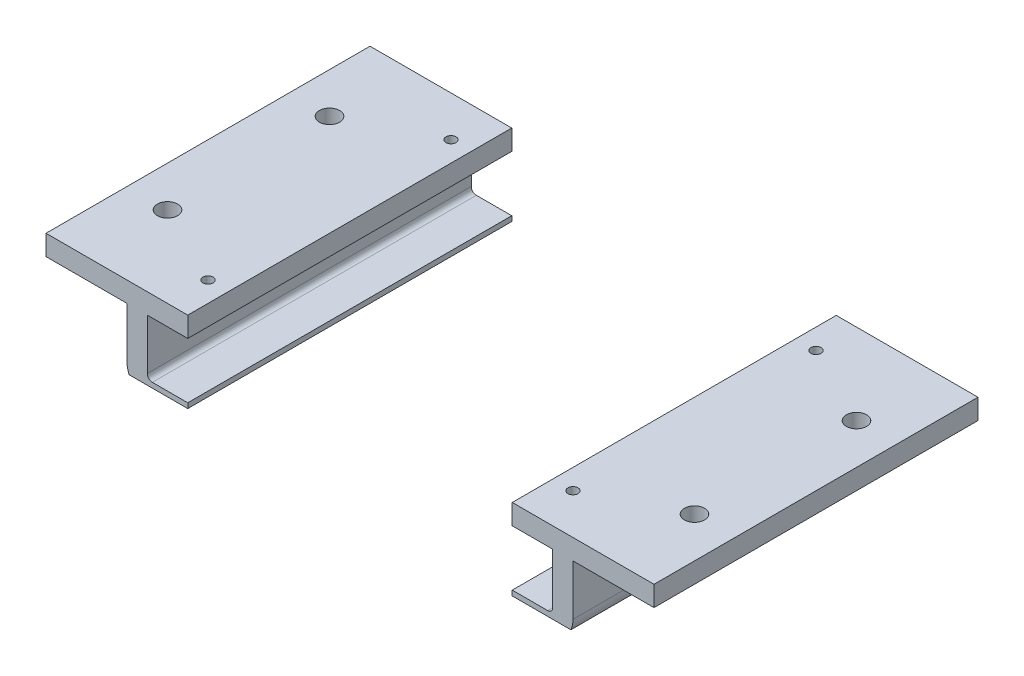
from build123d import *

# Parameters (mm, degrees)
BOSS_EXTRUDE2_DEPTH = 101.6
CUT_EXTRUDE1_REACH  = 143.615
SKETCH2_R           = 1.5875
SKETCH2_R_2         = 3.175


with BuildPart() as part:
    # Sketch1 → Boss-Extrude2 (new body)
    with BuildSketch(Plane.XY):
        with BuildLine():
            Line((69.9262, 1.5875), (69.9262, 17.4625))
            Line((69.9262, 17.4625), (95.3262, 17.4625))
            Line((95.3262, 17.4625), (95.3262, 23.8125))
            Line((95.3262, 23.8125), (50.8762, 23.8125))
            Line((50.8762, 23.8125), (50.8762, 17.4625))
            Line((50.8762, 17.4625), (63.5762, 17.4625))
            Line((63.5762, 17.4625), (63.5762, 1.5875))
            ThreePointArc((63.5762, 1.5875), (63.111232015, 0.464967985), (61.9887, 0))
            Line((61.9887, 0), (50.8762, 0))
            Line((50.8762, 0), (50.8762, -1.5875))
            Line((50.8762, -1.5875), (69.263538916, -1.5875))
            ThreePointArc((69.263538916, -1.5875), (69.758768859, -0.034207797), (69.9262, 1.5875))
        make_face()
    extrude(amount=-BOSS_EXTRUDE2_DEPTH)

    # Sketch2 → Cut-Extrude1 (cut, up to next)
    with BuildSketch(Plane(origin=(0, 23.8125, 0), x_dir=(1, 0, 0), z_dir=(0, 1, 0)), mode=Mode.PRIVATE) as cut_extrude1_sk1:
        with Locations((57.2262, 88.9)):
            Circle(SKETCH2_R)
    cut_extrude1_tool1 = extrude(cut_extrude1_sk1.sketch, amount=-CUT_EXTRUDE1_REACH, mode=Mode.PRIVATE) & part.part
    # Sketch2 → Cut-Extrude1 (cut, up to next)
    with BuildSketch(Plane(origin=(0, 23.8125, 0), x_dir=(1, 0, 0), z_dir=(0, 1, 0)), mode=Mode.PRIVATE) as cut_extrude1_sk2:
        with Locations((57.2262, 12.7)):
            Circle(SKETCH2_R)
    cut_extrude1_tool2 = extrude(cut_extrude1_sk2.sketch, amount=-CUT_EXTRUDE1_REACH, mode=Mode.PRIVATE) & part.part
    # Sketch2 → Cut-Extrude1 (cut, up to next)
    with BuildSketch(Plane(origin=(0, 23.8125, 0), x_dir=(1, 0, 0), z_dir=(0, 1, 0)), mode=Mode.PRIVATE) as cut_extrude1_sk3:
        with Locations((82.6262, 76.2)):
            Circle(SKETCH2_R_2)
    cut_extrude1_tool3 = extrude(cut_extrude1_sk3.sketch, amount=-CUT_EXTRUDE1_REACH, mode=Mode.PRIVATE) & part.part
    # Sketch2 → Cut-Extrude1 (cut, up to next)
    with BuildSketch(Plane(origin=(0, 23.8125, 0), x_dir=(1, 0, 0), z_dir=(0, 1, 0)), mode=Mode.PRIVATE) as cut_extrude1_sk4:
        with Locations((82.6262, 25.4)):
            Circle(SKETCH2_R_2)
    cut_extrude1_tool4 = extrude(cut_extrude1_sk4.sketch, amount=-CUT_EXTRUDE1_REACH, mode=Mode.PRIVATE) & part.part
    add(cut_extrude1_tool1.solids().sort_by_distance((57.2262, 23.8125, -88.9))[0], mode=Mode.SUBTRACT)
    add(cut_extrude1_tool2.solids().sort_by_distance((57.2262, 23.8125, -12.7))[0], mode=Mode.SUBTRACT)
    add(cut_extrude1_tool3.solids().sort_by_distance((82.6262, 23.8125, -76.2))[0], mode=Mode.SUBTRACT)
    add(cut_extrude1_tool4.solids().sort_by_distance((82.6262, 23.8125, -25.4))[0], mode=Mode.SUBTRACT)


with BuildPart() as body_2:
    # Mirror5: mirrored copy
    add(part.part.mirror(Plane.ZY))


solid = Compound([part.part, body_2.part])
